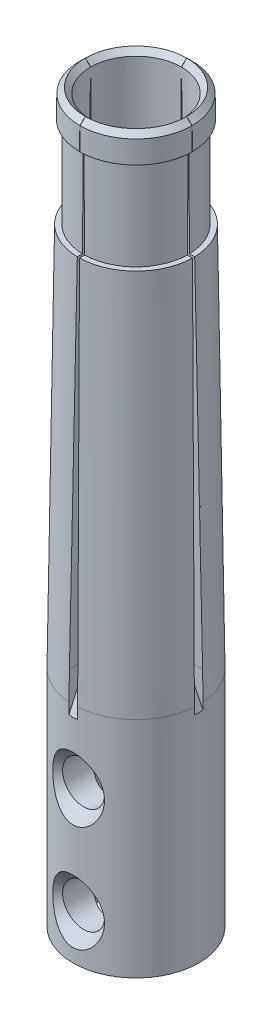
from build123d import *

# Parameters (mm, degrees)
SKETCH1_W               = 4.5
SKETCH1_H               = 16
SKETCH2_R               = 3.25
CUT_EXTRUDE1_DEPTH      = 34.5
SKETCH3_R               = 2.6
CUT_EXTRUDE2_DEPTH      = 15.5
CUT_EXTRUDE3_DEPTH      = 53.964610826
CUT_EXTRUDE4_DEPTH      = 53.96461095
CUT_EXTRUDE5_DEPTH      = 0.3
CUT_EXTRUDE5_DEPTH_BACK = 0.3
CUT_EXTRUDE6_DEPTH      = 0.3
CUT_EXTRUDE6_DEPTH_BACK = 0.3
SKETCH15_R              = 4.674572256
SKETCH15_R_2            = 3.75
CUT_EXTRUDE7_DEPTH      = 6.5
CHAMFER1_SIZE           = 0.405672925
CHAMFER1_SIZE_2         = 0.4


with BuildPart() as part:
    # Sketch1 → Revolve1 (revolve)
    with BuildSketch(Plane.XY):
        Polygon((0, 16), (4.5, 16), (4, 52), (0, 52), align=None)
        with Locations((2.25, 8)):
            Rectangle(SKETCH1_W, SKETCH1_H)
    revolve(axis=Axis((0, 0, 0), (0, 1, 0)))

    # Sketch2 → Cut-Extrude1 (cut)
    with BuildSketch(Plane(origin=(0, 52, 0), x_dir=(1, 0, 0), z_dir=(0, 1, 0))):
        with Locations(Location((0, 0, 0), (0, 0, 270))):
            Circle(SKETCH2_R)
    extrude(amount=-CUT_EXTRUDE1_DEPTH, mode=Mode.SUBTRACT)

    # Sketch3 → Cut-Extrude2 (cut)
    with BuildSketch(Plane.XZ):
        with Locations(Location((0, -0.502631205, 0), (0, 0, 270))):
            Circle(SKETCH3_R)
    extrude(amount=-CUT_EXTRUDE2_DEPTH, mode=Mode.SUBTRACT)

    # Sketch5 → Cut-Extrude3 (cut, through all)
    with BuildSketch(Plane.ZY.offset(4.5)):
        Polygon((0.3, 18), (-0.3, 18), (-0.005, 52), (0.005, 52), align=None)
    extrude(amount=-CUT_EXTRUDE3_DEPTH, mode=Mode.SUBTRACT)

    # Sketch9 → Cut-Extrude4 (cut, through all)
    with BuildSketch(Plane.XY.offset(4.5)):
        Polygon((0.3, 18), (-0.3, 18), (-0.005, 52), (0.005, 52), align=None)
    extrude(amount=-CUT_EXTRUDE4_DEPTH, mode=Mode.SUBTRACT)

    # Sketch11 → Cut-Extrude5 (cut, two sides: drawn at the far end of the back side and taken through both)
    with BuildSketch(Plane.XY.offset(-CUT_EXTRUDE5_DEPTH_BACK)):
        Polygon((4.70526545, 18), (4.5, 15.5), (3.25, 18), align=None)
        Polygon((-3.25, 18), (-4.70526545, 18), (-4.5, 15.5), align=None)
    extrude(amount=CUT_EXTRUDE5_DEPTH + CUT_EXTRUDE5_DEPTH_BACK, mode=Mode.SUBTRACT)

    # Sketch14 → Cut-Extrude6 (cut, two sides: drawn at the far end of the back side and taken through both)
    with BuildSketch(Plane(origin=(0, 0, 0), x_dir=(0, 0, -1), z_dir=(1, 0, 0)).offset(-CUT_EXTRUDE6_DEPTH_BACK)):
        Polygon((4.63635838, 18), (4.5, 15.2), (3.25, 18), align=None)
        Polygon((-3.25, 18), (-4.63635838, 18), (-4.5, 15.2), align=None)
    extrude(amount=CUT_EXTRUDE6_DEPTH + CUT_EXTRUDE6_DEPTH_BACK, mode=Mode.SUBTRACT)

    # Sketch15 → Cut-Extrude7 (cut)
    with BuildSketch(Plane(origin=(0, 43.5, 0), x_dir=(1, 0, 0), z_dir=(0, 1, 0))):
        Circle(SKETCH15_R)
        Circle(SKETCH15_R_2, mode=Mode.SUBTRACT)
    extrude(amount=CUT_EXTRUDE7_DEPTH, mode=Mode.SUBTRACT)

    # CSK for M3 Oval Head Machine Screw1: read off the stored shape, not the designer's step
    # CSK for M3 Oval Head Machine Screw1 outl → CSK for M3 Oval Head Machine Screw1 (revolve, cut)
    with BuildSketch(Plane.XZ.offset(-10.8)):
        Polygon((0, 1.620808174), (1.5, 1.620808174), (1.5, 3.75), (2.250171478, 4.500171478), (0, 4.500171478), align=None)
    revolve(axis=Axis((0, 10.8, 0), (0, 0, 1)), mode=Mode.SUBTRACT)

    # CSK for M3 Oval Head Machine Screw1 2 ou → CSK for M3 Oval Head Machine Screw1 2 (revolve, cut)
    with BuildSketch(Plane.XZ.offset(-3.2)):
        Polygon((0, 1.620808174), (1.5, 1.620808174), (1.5, 3.75), (2.250171478, 4.500171478), (0, 4.500171478), align=None)
    revolve(axis=Axis((0, 3.2, 0), (0, 0, 1)), mode=Mode.SUBTRACT)

    # Chamfer1
    # the kernel refuses this chamfer: 0.405672925, 0.4 mm, written as the material it takes off along each edge
    with BuildSketch(Plane(origin=(0, 52, 0), x_dir=(-0.9664500718694985, 0, -0.2568545475233819), z_dir=(0.2568545475233819, 0, -0.9664500718694985))) as chamfer1_piece_1:
        Polygon((4 - CHAMFER1_SIZE * 0.999999998918, 0), (4 + CHAMFER1_SIZE_2 * 0.0138875494908, -CHAMFER1_SIZE_2 * 0.999903563335), (4, 0), align=None)
    revolve(axis=Axis((0, 52, 0), (0, 1, 0)), revolution_arc=119.767007275, mode=Mode.SUBTRACT)
    with BuildSketch(Plane(origin=(0, 52, 0), x_dir=(-0.2568545475233686, 0, 0.9664500718695019), z_dir=(-0.9664500718695019, 0, -0.2568545475233686))) as chamfer1_piece_2:
        Polygon((4 - CHAMFER1_SIZE * 0.999999998918, 0), (4 + CHAMFER1_SIZE_2 * 0.0138875494908, -CHAMFER1_SIZE_2 * 0.999903563335), (4, 0), align=None)
    revolve(axis=Axis((0, 52, 0), (0, 1, 0)), revolution_arc=119.767007275, mode=Mode.SUBTRACT)
    with BuildSketch(Plane(origin=(0, 52, 0), x_dir=(0.9664500718695013, 0, 0.25685454752337145), z_dir=(-0.25685454752337145, 0, 0.9664500718695013))) as chamfer1_piece_3:
        Polygon((4 - CHAMFER1_SIZE * 0.999999998918, 0), (4 + CHAMFER1_SIZE_2 * 0.0138875494908, -CHAMFER1_SIZE_2 * 0.999903563335), (4, 0), align=None)
    revolve(axis=Axis((0, 52, 0), (0, 1, 0)), revolution_arc=119.767007275, mode=Mode.SUBTRACT)
    with BuildSketch(Plane(origin=(0, 52, 0), x_dir=(0.2568545475233668, 0, -0.9664500718695025), z_dir=(0.9664500718695025, 0, 0.2568545475233668))) as chamfer1_piece_4:
        Polygon((4 - CHAMFER1_SIZE * 0.999999998918, 0), (4 + CHAMFER1_SIZE_2 * 0.0138875494908, -CHAMFER1_SIZE_2 * 0.999903563335), (4, 0), align=None)
    revolve(axis=Axis((0, 52, 0), (0, 1, 0)), revolution_arc=119.767007275, mode=Mode.SUBTRACT)
    with BuildSketch(Plane(origin=(0, 52, 0), x_dir=(-0.950764457827211, 0, -0.30991441678716625), z_dir=(0.30991441678716625, 0, -0.950764457827211))) as chamfer1_piece_5:
        Polygon((3.25, -CHAMFER1_SIZE_2), (3.25 + CHAMFER1_SIZE_2, 0), (3.25, 0), align=None)
    revolve(axis=Axis((0, 52, 0), (0, 1, 0)), revolution_arc=126.108145853, mode=Mode.SUBTRACT)
    with BuildSketch(Plane(origin=(0, 52, 0), x_dir=(-0.3099144167871693, 0, 0.9507644578272101), z_dir=(-0.9507644578272101, 0, -0.3099144167871693))) as chamfer1_piece_6:
        Polygon((3.25, -CHAMFER1_SIZE_2), (3.25 + CHAMFER1_SIZE_2, 0), (3.25, 0), align=None)
    revolve(axis=Axis((0, 52, 0), (0, 1, 0)), revolution_arc=126.108145853, mode=Mode.SUBTRACT)
    with BuildSketch(Plane(origin=(0, 52, 0), x_dir=(0.9507644578272096, 0, 0.3099144167871707), z_dir=(-0.3099144167871707, 0, 0.9507644578272096))) as chamfer1_piece_7:
        Polygon((3.25, -CHAMFER1_SIZE_2), (3.25 + CHAMFER1_SIZE_2, 0), (3.25, 0), align=None)
    revolve(axis=Axis((0, 52, 0), (0, 1, 0)), revolution_arc=126.108145853, mode=Mode.SUBTRACT)
    with BuildSketch(Plane(origin=(0, 52, 0), x_dir=(0.309914416787165, 0, -0.9507644578272114), z_dir=(0.9507644578272114, 0, 0.309914416787165))) as chamfer1_piece_8:
        Polygon((3.25, -CHAMFER1_SIZE_2), (3.25 + CHAMFER1_SIZE_2, 0), (3.25, 0), align=None)
    revolve(axis=Axis((0, 52, 0), (0, 1, 0)), revolution_arc=126.108145853, mode=Mode.SUBTRACT)
    with BuildSketch(Plane(origin=(0, 0, -0.502631205), x_dir=(0, 0, -1), z_dir=(-1, 0, 0))) as chamfer1_piece_9:
        Polygon((2.6 + CHAMFER1_SIZE_2, 0), (2.6, -CHAMFER1_SIZE_2), (2.6, 0), align=None)
    revolve(axis=Axis((0, 0, -0.502631205), (0, -1, 0)), mode=Mode.SUBTRACT)


solid = part.part
